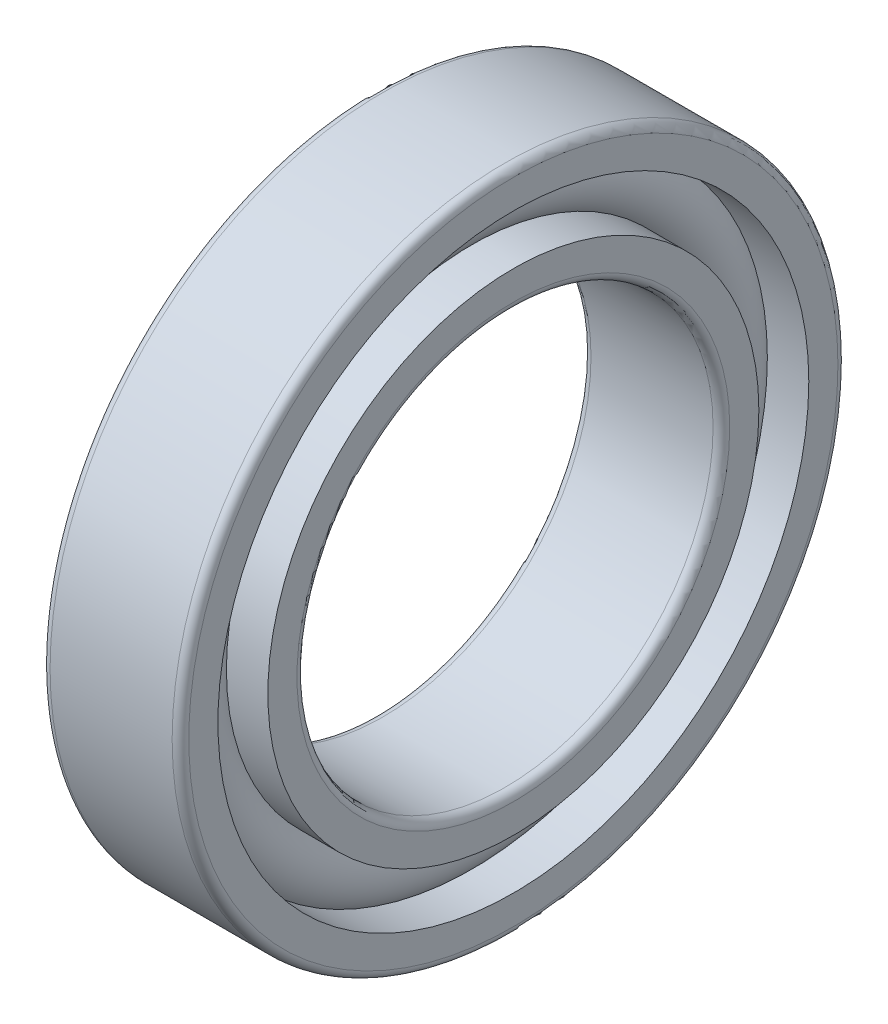
from build123d import *

# Parameters (mm, degrees)
CAGSPISKE_W     = 0.27
CAGSPISKE_H     = 0.45
CAGESPINE_ANGLE = 0.001
BALSIMSKE_R     = 1.35


with BuildPart() as part:
    # CagSpiSke → CageSpine (revolve)
    with BuildSketch(Plane.XY):
        with Locations((0, 9.75)):
            Rectangle(CAGSPISKE_W, CAGSPISKE_H)
    revolve(axis=Axis((-20.6375, 0, 0), (-1, 0, 0)), revolution_arc=CAGESPINE_ANGLE)

    # BalSimSke → BallsSimplified (revolve)
    with BuildSketch(Plane.XY):
        with Locations((0, 9.75)):
            Circle(BALSIMSKE_R)
    revolve(axis=Axis((-10, 0, 0), (1, 0, 0)))

    # InnRacSke → InnerRace (revolve)
    with BuildSketch(Plane.XY):
        with BuildLine():
            Line((-0.972432517, 8.85), (-2.5, 8.85))
            Line((-2.5, 8.85), (-2.5, 7.8))
            ThreePointArc((-2.5, 7.8), (-2.412132034, 7.587867966), (-2.2, 7.5))
            Line((-2.2, 7.5), (2.2, 7.5))
            ThreePointArc((2.2, 7.5), (2.412132034, 7.587867966), (2.5, 7.8))
            Line((2.5, 7.8), (2.5, 8.85))
            Line((2.5, 8.85), (0.972432517, 8.85))
            ThreePointArc((0.972432517, 8.85), (0, 8.425), (-0.972432517, 8.85))
        make_face()
    revolve(axis=Axis((-20.6375, 0, 0), (1, 0, 0)))

    # OutRacSke → OuterRace (revolve)
    with BuildSketch(Plane.XY):
        with BuildLine():
            Line((-0.972432517, 10.65), (-2.5, 10.65))
            Line((-2.5, 10.65), (-2.5, 11.7))
            ThreePointArc((-2.5, 11.7), (-2.412132034, 11.912132034), (-2.2, 12))
            Line((-2.2, 12), (2.2, 12))
            ThreePointArc((2.2, 12), (2.412132034, 11.912132034), (2.5, 11.7))
            Line((2.5, 11.7), (2.5, 10.65))
            Line((2.5, 10.65), (0.972432517, 10.65))
            ThreePointArc((0.972432517, 10.65), (0, 11.075), (-0.972432517, 10.65))
        make_face()
    revolve(axis=Axis((-20.6375, 0, 0), (1, 0, 0)))


solid = part.part
